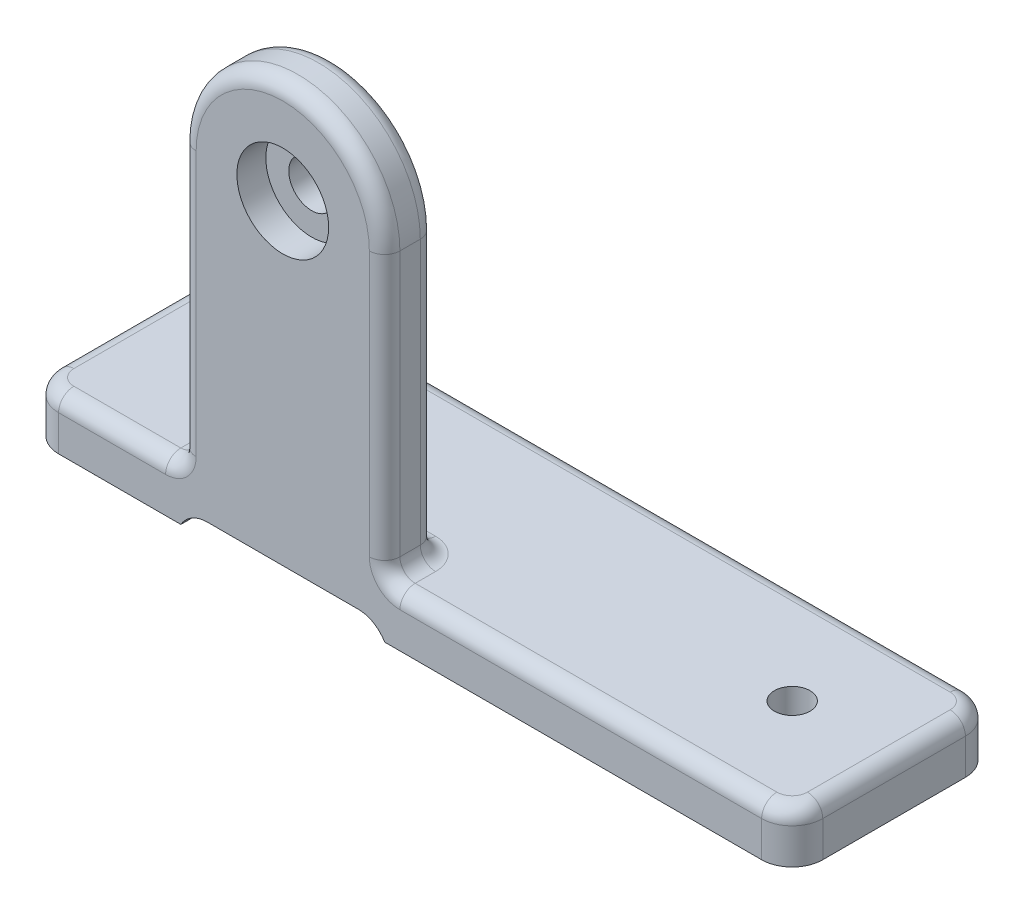
from build123d import *

# Parameters (mm, degrees)
SKETCH1_W                               = 150
SKETCH1_H                               = 40
BASE_PLATE_DEPTH                        = 10
VERT_BOSS_DEPTH                         = 10
SKETCH5_W                               = 40
SKETCH5_H                               = 3
SLOT_DEPTH                              = 177.988700204
F_7_0_7_DIAMETER_HOLE1_D                = 7
CBORE_FOR_M8_HEX_HEAD_BOLT1_D           = 9
CBORE_FOR_M8_HEX_HEAD_BOLT1_CBORE_D     = 18.01
CBORE_FOR_M8_HEX_HEAD_BOLT1_CBORE_DEPTH = 5.68
FILLET1_R                               = 6
FILLET2_R                               = 3


with BuildPart() as part:
    # Sketch1 → Base Plate (new body)
    with BuildSketch(Plane(origin=(0, 0, 0), x_dir=(1, 0, 0), z_dir=(0, 1, 0))):
        with Locations((75, 20)):
            Rectangle(SKETCH1_W, SKETCH1_H)
    extrude(amount=BASE_PLATE_DEPTH)

    # Sketch2 → Vert Boss (add)
    with BuildSketch(Plane.XY):
        with BuildLine():
            Line((30, 0), (30, 65))
            ThreePointArc((30, 65), (50, 85), (70, 65))
            Line((70, 65), (70, 0))
            Line((70, 0), (30, 0))
        make_face()
    extrude(amount=-VERT_BOSS_DEPTH)

    # Sketch5 → Slot (cut, through all)
    with BuildSketch(Plane.XY):
        with Locations((50, 1.5)):
            Rectangle(SKETCH5_W, SKETCH5_H)
    extrude(amount=-SLOT_DEPTH, mode=Mode.SUBTRACT)

    # Ø7.0 (7) Diameter Hole1 (through all)
    with Locations(Plane(origin=(0, 10, 0), x_dir=(-1, 0, 0), z_dir=(0, 1, 0))):
        with Locations((-130, -20), (-20, -20)):
            Hole(F_7_0_7_DIAMETER_HOLE1_D / 2)

    # CBORE for M8 Hex Head Bolt1 (through all)
    with Locations(Plane.XY):
        with Locations((50, 65)):
            CounterBoreHole(CBORE_FOR_M8_HEX_HEAD_BOLT1_D / 2, CBORE_FOR_M8_HEX_HEAD_BOLT1_CBORE_D / 2, CBORE_FOR_M8_HEX_HEAD_BOLT1_CBORE_DEPTH)

    # Fillet1
    # the kernel refuses this fillet: 6 mm, written as the material it adds along each edge
    with BuildSketch(Plane(origin=(70, 3, 0), x_dir=(-1, 0, 0), z_dir=(0, 0, -1))) as fillet1_piece_1:
        with BuildLine():
            CenterArc((5.196152423, -6), FILLET1_R, 90, 60)
            Line((0, -3), (0, 0))
            Line((0, 0), (5.196152423, 0))
        make_face()
    extrude(amount=40)
    with BuildSketch(Plane(origin=(30, 3, 0), x_dir=(0, -1, 0), z_dir=(0, 0, -1))) as fillet1_piece_2:
        with BuildLine():
            CenterArc((6, -5.196152423), FILLET1_R, 120, 60)
            Line((0, -5.196152423), (0, 0))
            Line((0, 0), (3, 0))
        make_face()
    extrude(amount=40)
    # the kernel refuses this fillet: 6 mm, written as the material it takes off along each edge
    with BuildSketch(Plane(origin=(0, -15, 0), x_dir=(1, 0, 0), z_dir=(0, 1, 0)), Plane(origin=(0, -15, -40), x_dir=(0, 0, 1), z_dir=(0, 1, 0))) as fillet1_2_piece_1:
        with BuildLine():
            CenterArc((FILLET1_R, FILLET1_R), FILLET1_R, 180, 90)
            Line((0, FILLET1_R), (0, 0))
            Line((0, 0), (FILLET1_R, 0))
        make_face()
    extrude(amount=40, mode=Mode.SUBTRACT)
    with BuildSketch(Plane(origin=(150, -15, -40), x_dir=(0, 0, 1), z_dir=(0, 1, 0)), Plane(origin=(150, -15, 0), x_dir=(-1, 0, 0), z_dir=(0, 1, 0))) as fillet1_2_piece_2:
        with BuildLine():
            CenterArc((FILLET1_R, -FILLET1_R), FILLET1_R, 90, 90)
            Line((0, -FILLET1_R), (0, 0))
            Line((0, 0), (FILLET1_R, 0))
        make_face()
    extrude(amount=40, mode=Mode.SUBTRACT)

    # Fillet2
    fillet2_edges = [part.edges().sort_by_distance(p)[0] for p in [
        (107, 10, 0),
        (30, 37.5, -10),
        (70, 37.5, -10),
        (30, 37.5, 0),
        (70, 37.5, 0),
        (50, 85, 0),
        (30, 10, -5),
        (50, 85, -10),
        (70, 10, -5),
        (50, 10, -10),
        (18, 10, 0),
        (0, 10, -20),
        (150, 10, -20),
        (75, 10, -40),
        (148.242640687, 10, -1.757359313),
        (148.242640687, 10, -38.242640687),
        (1.757359313, 10, -38.242640687),
        (1.757359313, 10, -1.757359313),
    ]]
    fillet(fillet2_edges, radius=FILLET2_R)


solid = part.part
